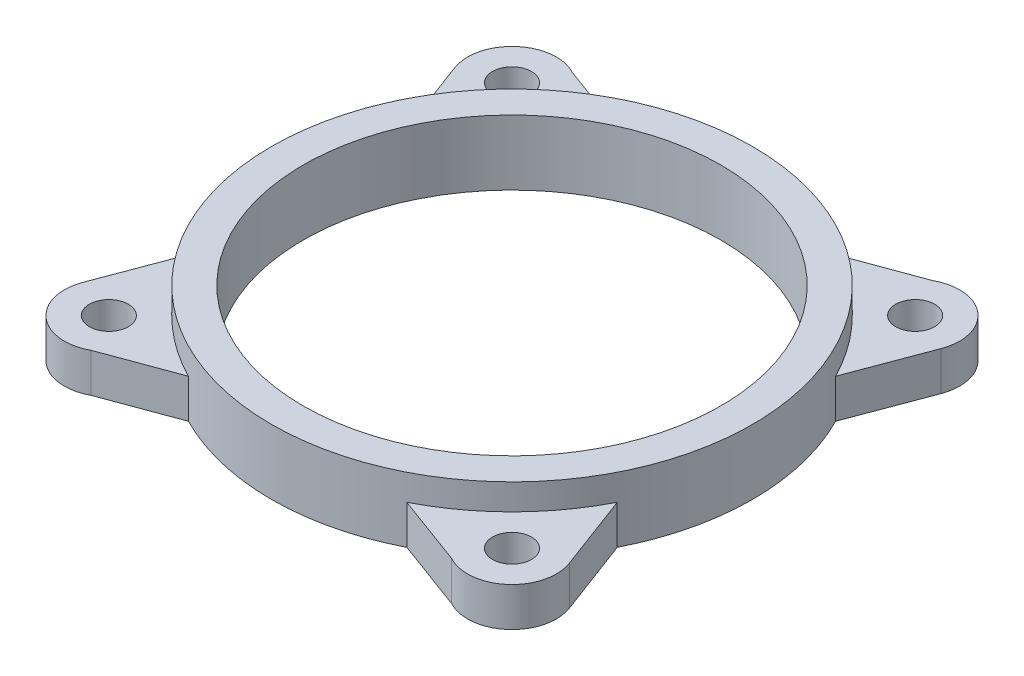
from build123d import *

# Parameters (mm, degrees)
SKETCH2_R           = 18.5
SKETCH2_R_2         = 16.05
BOSS_EXTRUDE1_DEPTH = 5
SKETCH3_R           = 1.5
BOSS_EXTRUDE2_DEPTH = 3


with BuildPart() as part:
    # Sketch2 → Boss-Extrude1 (new body)
    with BuildSketch(Plane(origin=(0, 9, 0), x_dir=(1, 0, 0), z_dir=(0, 1, 0))):
        with Locations((-0.5, 0)):
            Circle(SKETCH2_R)
        with Locations((-0.5, 0)):
            Circle(SKETCH2_R_2, mode=Mode.SUBTRACT)
    extrude(amount=BOSS_EXTRUDE1_DEPTH)

    # Sketch3 → Boss-Extrude2 (add)
    # profile 1 of 4: a face of its own
    with BuildSketch(Plane.XZ.offset(-9)):
        with BuildLine():
            ThreePointArc((18.20220612, 14.29816892), (17.240947793, 18.08392627), (13.357282137, 18.5))
            Line((13.357282137, 18.5), (7.893757897, 16.48620115))
            ThreePointArc((7.893757897, 16.48620115), (12.581475452, 13.081475452), (15.98620115, 8.393757897))
            Line((15.98620115, 8.393757897), (18.20220612, 14.29816892))
        make_face()
        with Locations((15, 15.5)):
            Circle(SKETCH3_R, mode=Mode.SUBTRACT)
    # profile 2 of 4: a face of its own
    with BuildSketch(Plane.XZ.offset(-9)):
        with BuildLine():
            ThreePointArc((-16.98620115, 8.393757897), (-13.581475452, 13.081475452), (-8.893757897, 16.48620115))
            Line((-8.893757897, 16.48620115), (-14.357282137, 18.5))
            ThreePointArc((-14.357282137, 18.5), (-18.240947793, 18.08392627), (-19.20220612, 14.29816892))
            Line((-19.20220612, 14.29816892), (-16.98620115, 8.393757897))
        make_face()
        with Locations((-16, 15.5)):
            Circle(SKETCH3_R, mode=Mode.SUBTRACT)
    # profile 3 of 4: a face of its own
    with BuildSketch(Plane.XZ.offset(-9)):
        with BuildLine():
            Line((18.20220612, -14.29816892), (15.98620115, -8.393757897))
            ThreePointArc((15.98620115, -8.393757897), (12.581475452, -13.081475452), (7.893757897, -16.48620115))
            Line((7.893757897, -16.48620115), (13.357282137, -18.5))
            ThreePointArc((13.357282137, -18.5), (17.240947793, -18.08392627), (18.20220612, -14.29816892))
        make_face()
        with Locations((15, -15.5)):
            Circle(SKETCH3_R, mode=Mode.SUBTRACT)
    # profile 4 of 4: a face of its own
    with BuildSketch(Plane.XZ.offset(-9)):
        with BuildLine():
            ThreePointArc((-8.893757897, -16.48620115), (-13.581475452, -13.081475452), (-16.98620115, -8.393757897))
            Line((-16.98620115, -8.393757897), (-19.20220612, -14.29816892))
            ThreePointArc((-19.20220612, -14.29816892), (-18.240947793, -18.08392627), (-14.357282137, -18.5))
            Line((-14.357282137, -18.5), (-8.893757897, -16.48620115))
        make_face()
        with Locations((-16, -15.5)):
            Circle(SKETCH3_R, mode=Mode.SUBTRACT)
    extrude(amount=-BOSS_EXTRUDE2_DEPTH)


solid = part.part
